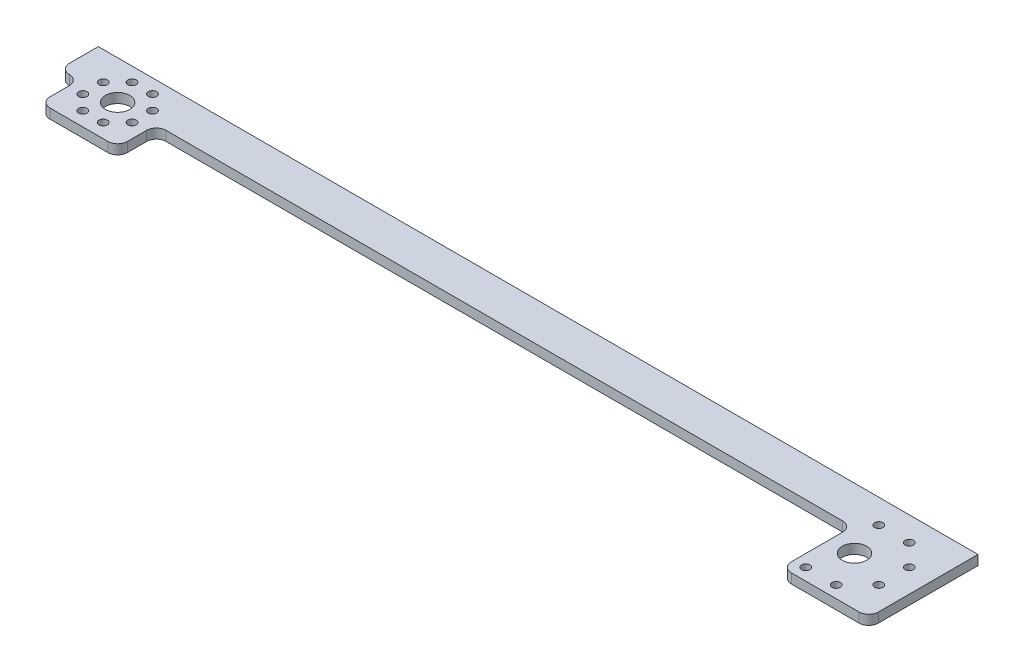
from build123d import *

# Parameters (mm, degrees)
BOSS_EXTRUDE1_DEPTH       = 6.35
M5_CLEARANCE_HOLE1_D      = 5.5
M5_CLEARANCE_HOLE1_DEPTH  = 12.7
M5_CLEARANCE_HOLE1_TIP    = 1.652366702
F_6_CLEARANCE_HOLE2_D     = 3.7973
F_6_CLEARANCE_HOLE2_DEPTH = 12.7
F_6_CLEARANCE_HOLE2_TIP   = 1.140824014
M5_CLEARANCE_HOLE2_D      = 5.5
M5_CLEARANCE_HOLE2_DEPTH  = 12.7
M5_CLEARANCE_HOLE2_TIP    = 1.652366702
FILLET1_R                 = 6.35
SKETCH8_R                 = 8
CUT_EXTRUDE1_DEPTH        = 6.35


with BuildPart() as part:
    # Sketch1 → Boss-Extrude1 (new body)
    with BuildSketch(Plane(origin=(0, 0, 0), x_dir=(1, 0, 0), z_dir=(0, 1, 0))):
        Polygon((-228.6, 12.7), (228.6, 12.7), (285.75, 12.7), (285.75, -59.055), (228.6, -59.055), (228.6, -12.7), (-228.6, -12.7), (-228.6, -38.1), (-279.4, -38.1), (-279.4, -12.7), (-292.1, -12.7), (-292.1, 12.7), (-279.4, 12.7), align=None)
    extrude(amount=BOSS_EXTRUDE1_DEPTH)

    # M5 Clearance Hole1
    with Locations(Plane(origin=(0, 6.35, 0), x_dir=(1, 0, 0), z_dir=(0, 1, 0))):
        with Locations((-270.167891819, -6.003039934), (-260.696960066, -28.867891819), (-237.832108181, -19.396960066), (-260.696960066, 3.467891819), (-247.303039934, 3.467891819), (-237.832108181, -6.003039934), (-270.167891819, -19.396960066), (-247.303039934, -28.867891819)):
            Hole(M5_CLEARANCE_HOLE1_D / 2, depth=M5_CLEARANCE_HOLE1_DEPTH)
            with Locations((0, 0, -(M5_CLEARANCE_HOLE1_DEPTH + M5_CLEARANCE_HOLE1_TIP / 2))):  # 118° drill point
                Cone(0, M5_CLEARANCE_HOLE1_D / 2, M5_CLEARANCE_HOLE1_TIP, mode=Mode.SUBTRACT)

    # #6 Clearance Hole2
    with Locations(Plane(origin=(0, 0, -12.7), x_dir=(-1, 0, 0), z_dir=(0, 0, -1))):
        with Locations((279.4, 3.175), (215.9, 3.175), (0, 3.175), (-215.9, 3.175), (-276.225, 3.175)):
            Hole(F_6_CLEARANCE_HOLE2_D / 2, depth=F_6_CLEARANCE_HOLE2_DEPTH)
            with Locations((0, 0, -(F_6_CLEARANCE_HOLE2_DEPTH + F_6_CLEARANCE_HOLE2_TIP / 2))):  # 118° drill point
                Cone(0, F_6_CLEARANCE_HOLE2_D / 2, F_6_CLEARANCE_HOLE2_TIP, mode=Mode.SUBTRACT)

    # M5 Clearance Hole2
    with Locations(Plane(origin=(0, 6.35, 0), x_dir=(1, 0, 0), z_dir=(0, 1, 0))):
        with Locations((218.475, -17.174999994), (218.475, -37.174999994), (244.475, -27.174999994), (256.475, -3.175), (256.475, -51.175), (236.475, -3.175), (236.475, -51.175), (270.475, -17.174999994), (270.475, -37.174999994)):
            Hole(M5_CLEARANCE_HOLE2_D / 2, depth=M5_CLEARANCE_HOLE2_DEPTH)
            with Locations((0, 0, -(M5_CLEARANCE_HOLE2_DEPTH + M5_CLEARANCE_HOLE2_TIP / 2))):  # 118° drill point
                Cone(0, M5_CLEARANCE_HOLE2_D / 2, M5_CLEARANCE_HOLE2_TIP, mode=Mode.SUBTRACT)

    # Fillet1
    fillet1_edges = [part.edges().sort_by_distance(p)[0] for p in [
        (285.75, 3.175, 59.055),
        (228.6, 3.175, 59.055),
        (228.6, 3.175, 12.7),
        (-228.6, 3.175, 12.7),
        (-228.6, 3.175, 38.1),
        (-279.4, 3.175, 38.1),
        (-279.4, 3.175, 12.7),
        (-292.1, 3.175, 12.7),
    ]]
    fillet(fillet1_edges, radius=FILLET1_R - 0.0001)  # a hair under: the kernel refuses the full size

    # Sketch8 → Cut-Extrude1 (cut)
    with BuildSketch(Plane(origin=(0, 6.35, 0), x_dir=(1, 0, 0), z_dir=(0, 1, 0))):
        with Locations(Location((-254, -12.7, 0), (0, 0, 270))):
            Circle(SKETCH8_R)
        with Locations(Location((244.475, -27.174999994, 0), (0, 0, 270))):
            Circle(SKETCH8_R)
    extrude(amount=-CUT_EXTRUDE1_DEPTH, mode=Mode.SUBTRACT)


solid = part.part
